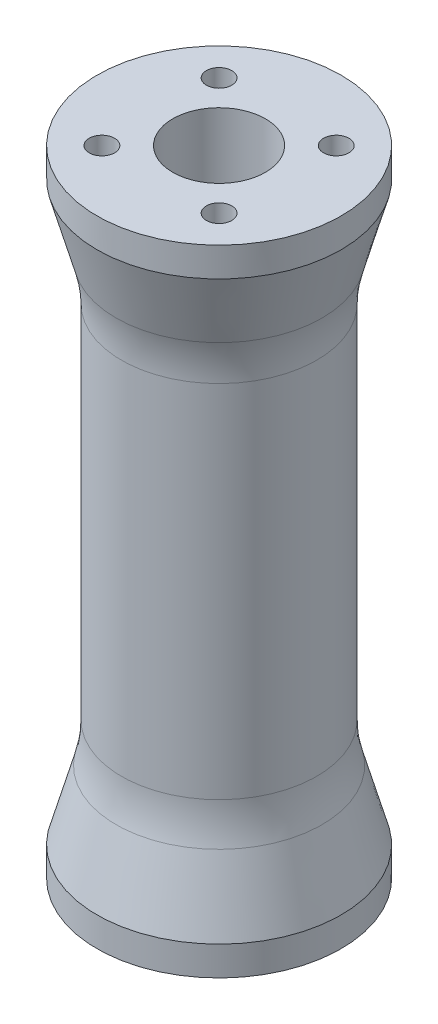
from build123d import *

# Parameters (mm, degrees)
SKETCH2_R          = 1.3
CUT_EXTRUDE1_DEPTH = 7
SKETCH5_R          = 4.75
CUT_EXTRUDE2_DEPTH = 68.360967927
FILLET1_R          = 15
FILLET2_R          = 4


with BuildPart() as part:
    # Sketch1 → Revolve1 (revolve)
    with BuildSketch(Plane.XY):
        Polygon((0, -32.5), (0, 32.5), (-12.5, 32.5), (-12.5, 29.5), (-10, 20.5), (-10, -20.5), (-12.5, -29.5), (-12.5, -32.5), align=None)
    revolve(axis=Axis((0, -32.5, 0), (0, 1, 0)))

    # Sketch2 → Cut-Extrude1 (cut)
    with BuildSketch(Plane(origin=(0, 32.5, 0), x_dir=(1, 0, 0), z_dir=(0, 1, 0))):
        with Locations((-6, 6)):
            Circle(SKETCH2_R)
        with Locations((6, 6)):
            Circle(SKETCH2_R)
        with Locations((-6, -6)):
            Circle(SKETCH2_R)
        with Locations((6, -6)):
            Circle(SKETCH2_R)
    cut_extrude1 = extrude(amount=-CUT_EXTRUDE1_DEPTH, mode=Mode.SUBTRACT)

    # Mirror1: Cut-Extrude1 across plane
    add(cut_extrude1.mirror(Plane.ZX), mode=Mode.SUBTRACT)

    # Sketch4 → Cut-Revolve1 (revolve, cut)
    with BuildSketch(Plane.XY):
        Polygon((0, 29.7), (-9, 20.7), (-9, -20.7), (0, -29.7), align=None)
    revolve(axis=Axis((0, 29.7, 0), (0, -1, 0)), mode=Mode.SUBTRACT)

    # Sketch5 → Cut-Extrude2 (cut, through all)
    with BuildSketch(Plane(origin=(0, 32.5, 0), x_dir=(1, 0, 0), z_dir=(0, 1, 0))):
        Circle(SKETCH5_R)
    extrude(amount=-CUT_EXTRUDE2_DEPTH, mode=Mode.SUBTRACT)

    # Fillet1
    fillet1_edges = [part.edges().sort_by_distance(p)[0] for p in [
        (10, -20.5, 0),
        (10, 20.5, 0),
    ]]
    fillet(fillet1_edges, radius=FILLET1_R)

    # Fillet2
    fillet2_edges = [part.edges().sort_by_distance(p)[0] for p in [
        (9, -20.7, 0),
        (9, 20.7, 0),
    ]]
    fillet(fillet2_edges, radius=FILLET2_R)


solid = part.part
